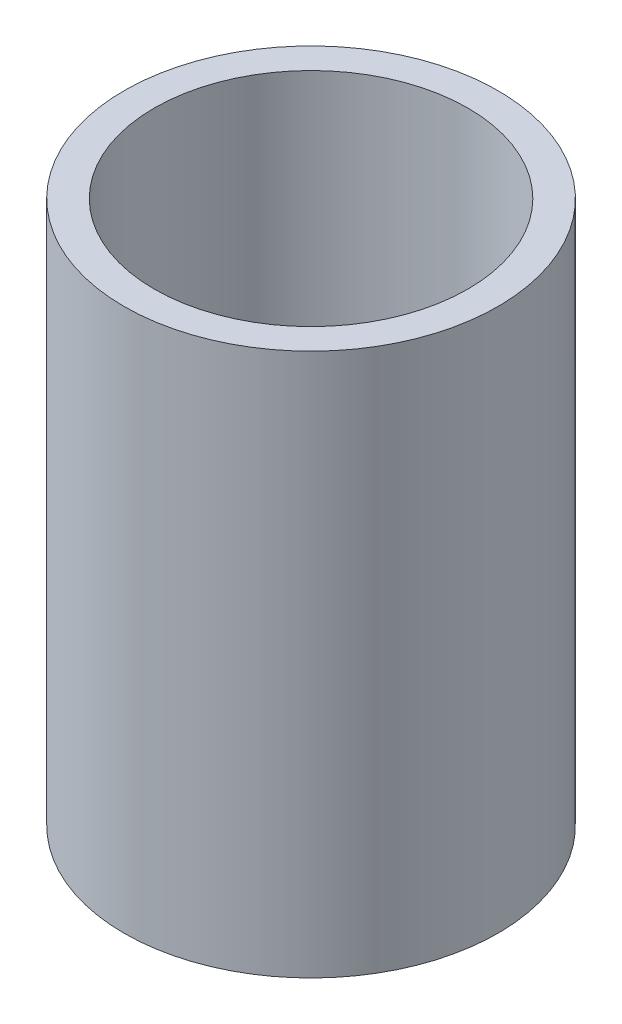
from build123d import *

# Parameters (mm, degrees)
SKETCH1_R           = 35
BOSS_EXTRUDE1_DEPTH = 101.633148004
SKETCH2_R           = 29.363053919
CUT_EXTRUDE1_DEPTH  = 114.045551762


with BuildPart() as part:
    # Sketch1 → Boss-Extrude1 (new body)
    with BuildSketch(Plane(origin=(0, 0, 0), x_dir=(1, 0, 0), z_dir=(0, 1, 0))):
        Circle(SKETCH1_R)
    extrude(amount=BOSS_EXTRUDE1_DEPTH)

    # Sketch2 → Cut-Extrude1 (cut, through all)
    with BuildSketch(Plane(origin=(0, 0, 0), x_dir=(1, 0, 0), z_dir=(0, 1, 0))):
        Circle(SKETCH2_R)
    extrude(amount=CUT_EXTRUDE1_DEPTH, mode=Mode.SUBTRACT)


solid = part.part
